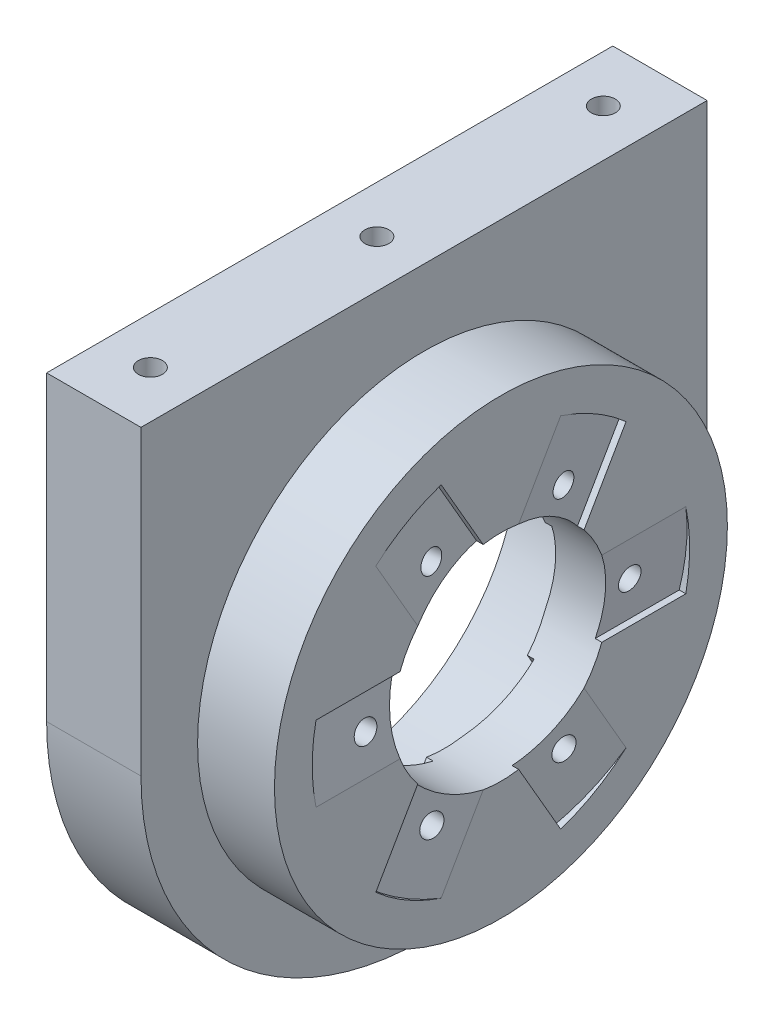
from build123d import *
from build123d.topology import SkipClean

# Parameters (mm, degrees)
SKETCH7_R                  = 38.1
SKETCH7_R_2                = 18.1229
BOSS_EXTRUDE3_DEPTH        = 9.525
CUT_EXTRUDE4_REACH         = 1065.597
CUT_EXTRUDE4_END_RADIUS    = 31.75
CIRPATTERN1_COUNT          = 6
SKETCH19_R                 = 38.1
BOSS_EXTRUDE4_DEPTH        = 15.875
F_10_32_TAPPED_HOLE1_D     = 4.0386
F_10_32_TAPPED_HOLE1_DEPTH = 12.7
F_10_32_TAPPED_HOLE1_TIP   = 1.213317848


with BuildPart() as part:
    # Sketch1 → Revolve1 (revolve)
    with BuildSketch(Plane.XY, mode=Mode.PRIVATE) as revolve1_sk:
        Polygon((104.775, 1038.225), (104.775, 1044.575), (114.3, 1044.575), (114.3, 1054.1), (120.65, 1054.1), (120.65, 1044.575), (133.582417551, 1044.575), (133.582417551, 1038.225), align=None)
    revolve(revolve1_sk.sketch.rotate(Axis((184.382417551, 1006.475, 0), (-1, 0, 0)), 90), axis=Axis((184.382417551, 1006.475, 0), (-1, 0, 0)))

    # Sketch7 → Boss-Extrude3 (add)
    with BuildSketch(Plane(origin=(133.582417551, 0, 0), x_dir=(0, 0, -1), z_dir=(1, 0, 0))):
        with Locations((0, 1006.475)):
            Circle(SKETCH7_R)
        with Locations((0, 1006.475)):
            Circle(SKETCH7_R_2, mode=Mode.SUBTRACT)
    extrude(amount=-BOSS_EXTRUDE3_DEPTH)

    # Cut-Extrude4: up to this cylinder (the profile starts inside it)
    cut_extrude4_end = Plane(origin=(128.8199175, 1006.475, 0), z_dir=(1, 0, 0)) * Cylinder(CUT_EXTRUDE4_END_RADIUS, 2204.478263, mode=Mode.PRIVATE)
    # Sketch8 → Cut-Extrude4 (cut, up to the surface)
    with BuildSketch(Plane.XY, mode=Mode.PRIVATE) as cut_extrude4_sk1:
        Polygon((133.582417551, 1000.125), (133.582417551, 1012.825), (132.471311524, 1000.125), align=None)
    cut_extrude4_tool1 = extrude(cut_extrude4_sk1.sketch, amount=-CUT_EXTRUDE4_REACH, mode=Mode.PRIVATE) & cut_extrude4_end
    # Sketch8 → Cut-Extrude4 (cut, up to the surface)
    with BuildSketch(Plane.XY, mode=Mode.PRIVATE) as cut_extrude4_sk2:
        Polygon((124.057417551, 1012.825), (124.057417551, 1000.125), (125.168523578, 1012.825), align=None)
    cut_extrude4_tool2 = extrude(cut_extrude4_sk2.sketch, amount=-CUT_EXTRUDE4_REACH, mode=Mode.PRIVATE) & cut_extrude4_end
    cut_extrude4 = cut_extrude4_tool1.solids().sort_by_distance((133.212049, 1004.358333, 0))[0] + cut_extrude4_tool2.solids().sort_by_distance((124.427786, 1008.591667, 0))[0]
    add(cut_extrude4, mode=Mode.SUBTRACT)

    # Sketch18 → #10-24 Tapped Hole2 (revolve, cut)
    with BuildSketch(Plane(origin=(133.031084587, 1006.523235384, -22.225), x_dir=(0.08715574274765736, 0.9961946980917457, 0), z_dir=(0, 0, 1))):
        Polygon((0, 0), (0, 16.126824014), (1.89865, 14.986), (1.89865, 0), align=None)
    f_10_24_tapped_hole2 = revolve(axis=Axis((139.35692092, 1005.969796418, -22.225), (-0.9961946980917457, 0.08715574274765729, 0)), mode=Mode.SUBTRACT)

    # CirPattern1: Cut-Extrude4, #10-24 Tapped Hole2 ×6 about axis
    with SkipClean():  # the faces are left unmerged after this step: merging them gives an invalid solid
        cirpattern1_axis = Axis((0, 1006.475, 0), (1, 0, 0))
        add([cut_extrude4.rotate(cirpattern1_axis, i * 360 / CIRPATTERN1_COUNT) for i in range(1, CIRPATTERN1_COUNT)], mode=Mode.SUBTRACT)
        add([f_10_24_tapped_hole2.rotate(cirpattern1_axis, i * 360 / CIRPATTERN1_COUNT) for i in range(1, CIRPATTERN1_COUNT)], mode=Mode.SUBTRACT)
    add(part.part.scale(1), mode=Mode.REPLACE)  # the faces are merged on a copy

    # Sketch19 → Boss-Extrude4 (add)
    with SkipClean():  # the faces are left unmerged after this step: merging them gives an invalid solid
        with BuildSketch(Plane.ZY.offset(-120.65)):
            with BuildLine():
                Line((-47.625, 1006.475), (-47.625, 1057.275))
                Line((-47.625, 1057.275), (47.625, 1057.275))
                Line((47.625, 1057.275), (47.625, 1006.475))
                ThreePointArc((47.625, 1006.475), (0, 958.85), (-47.625, 1006.475))
            make_face()
            with Locations(Location((0, 1006.475, 0), (0, 0, 180))):
                Circle(SKETCH19_R, mode=Mode.SUBTRACT)
        extrude(amount=BOSS_EXTRUDE4_DEPTH)

    # #10-32 Tapped Hole1
    with Locations(Plane(origin=(0, 1057.275, 0), x_dir=(1, 0, 0), z_dir=(0, 1, 0))):
        with Locations((112.7125, 38.1), (112.7125, 0), (112.7125, -38.1)):
            Hole(F_10_32_TAPPED_HOLE1_D / 2, depth=F_10_32_TAPPED_HOLE1_DEPTH)
            with Locations((0, 0, -(F_10_32_TAPPED_HOLE1_DEPTH + F_10_32_TAPPED_HOLE1_TIP / 2))):  # 118° drill point
                Cone(0, F_10_32_TAPPED_HOLE1_D / 2, F_10_32_TAPPED_HOLE1_TIP, mode=Mode.SUBTRACT)


solid = part.part
